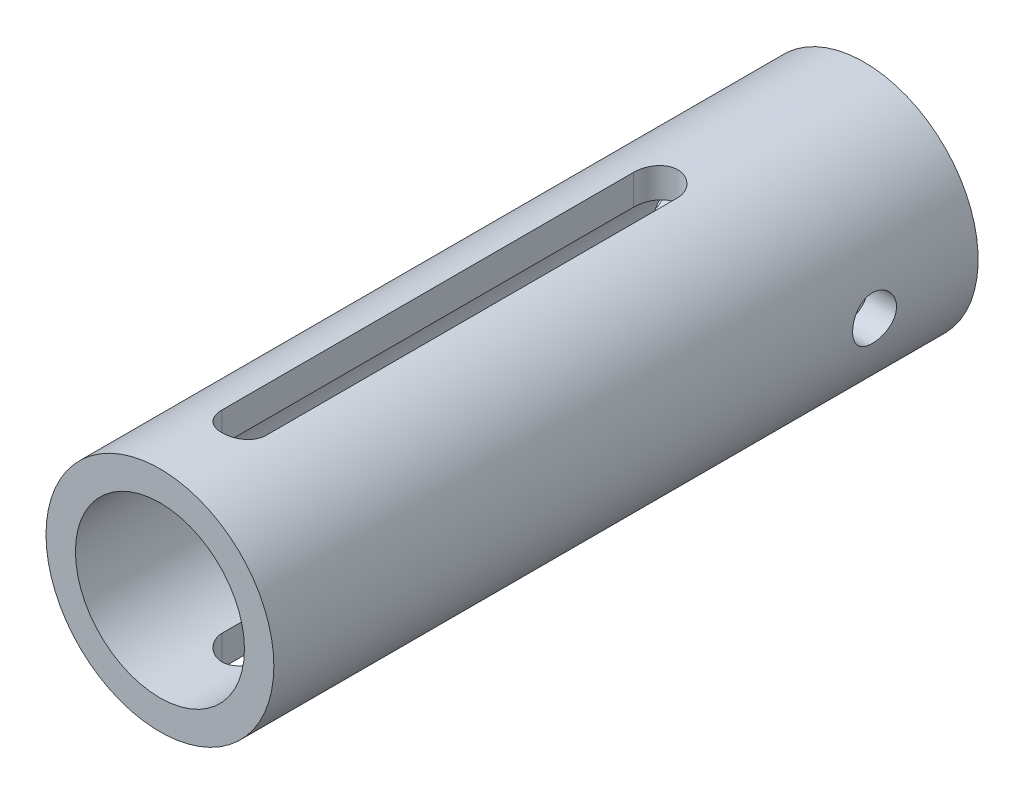
from build123d import *

# Parameters (mm, degrees)
SKETCH1_R                   = 17.4625
SKETCH1_R_2                 = 12.954
BOSS_EXTRUDE1_DEPTH         = 101.6
F_1_4_START                 = 12
F_1_4_CLEARANCE_SLOT1_DEPTH = 6
CUT_EXTRUDE1_REACH          = 106.558
CUT_EXTRUDE1_END_RADIUS     = 17.4625
CUT_EXTRUDE3_DEPTH          = 105.558298762
CUT_EXTRUDE3_DEPTH_BACK     = 105.558298762
SKETCH6_R                   = 3.3655
BOSS_EXTRUDE3_START         = 6.35
SKETCH8_R                   = 17.4625
BOSS_EXTRUDE3_DEPTH         = 6.35


with BuildPart() as part:
    # Sketch1 → Boss-Extrude1 (new body)
    with BuildSketch(Plane.XY):
        Circle(SKETCH1_R)
        Circle(SKETCH1_R_2, mode=Mode.SUBTRACT)
    extrude(amount=BOSS_EXTRUDE1_DEPTH)

    # 1/4 Clearance Slot1: read off the stored shape, not the designer's step
    # 1/4 Clearance Slot1 outline → 1/4 Clearance Slot1 (cut)
    with BuildSketch(Plane(origin=(0, 0, 0), x_dir=(1, 0, 0), z_dir=(0, 1, 0)).offset(F_1_4_START)):
        with BuildLine():
            Line((3.3782, -88.6968), (3.3782, -25.6032))
            ThreePointArc((3.3782, -25.6032), (0, -22.225), (-3.3782, -25.6032))
            Line((-3.3782, -25.6032), (-3.3782, -88.6968))
            ThreePointArc((-3.3782, -88.6968), (0, -92.075), (3.3782, -88.6968))
        make_face()
    extrude(amount=F_1_4_CLEARANCE_SLOT1_DEPTH, mode=Mode.SUBTRACT)

    # Cut-Extrude1: up to this cylinder (the profile starts inside it)
    cut_extrude1_end = Plane(origin=(0, 0, 57.15), z_dir=(0, 0, -1)) * Cylinder(CUT_EXTRUDE1_END_RADIUS, 249.041, mode=Mode.PRIVATE)
    # Sketch4 → Cut-Extrude1 (cut, up to the surface)
    with BuildSketch(Plane(origin=(0, 0, 0), x_dir=(1, 0, 0), z_dir=(0, 1, 0)), mode=Mode.PRIVATE) as cut_extrude1_sk1:
        with BuildLine():
            Line((-3.3782, -88.6968), (-3.3782, -25.6032))
            ThreePointArc((-3.3782, -25.6032), (0, -22.225), (3.3782, -25.6032))
            Line((3.3782, -25.6032), (3.3782, -88.6968))
            ThreePointArc((3.3782, -88.6968), (0, -92.075), (-3.3782, -88.6968))
        make_face()
    cut_extrude1_tool1 = extrude(cut_extrude1_sk1.sketch, amount=-CUT_EXTRUDE1_REACH, mode=Mode.PRIVATE) & cut_extrude1_end
    add(cut_extrude1_tool1.solids().sort_by_distance((0, 0, 57.15))[0], mode=Mode.SUBTRACT)

    # Sketch6 → Cut-Extrude3 (cut, two sides: drawn at the far end of the back side and taken through both)
    with BuildSketch(Plane(origin=(0, 0, 0), x_dir=(0, 0, -1), z_dir=(1, 0, 0)).offset(-CUT_EXTRUDE3_DEPTH_BACK)):
        with Locations((-9.525, 0)):
            Circle(SKETCH6_R)
    extrude(amount=CUT_EXTRUDE3_DEPTH + CUT_EXTRUDE3_DEPTH_BACK, mode=Mode.SUBTRACT)

    # Sketch8 → Boss-Extrude3 (add)
    with BuildSketch(Plane(origin=(0, 0, 0), x_dir=(-1, 0, 0), z_dir=(0, 0, -1)).offset(BOSS_EXTRUDE3_START)):
        Circle(SKETCH8_R)
    extrude(amount=-BOSS_EXTRUDE3_DEPTH)


solid = part.part
